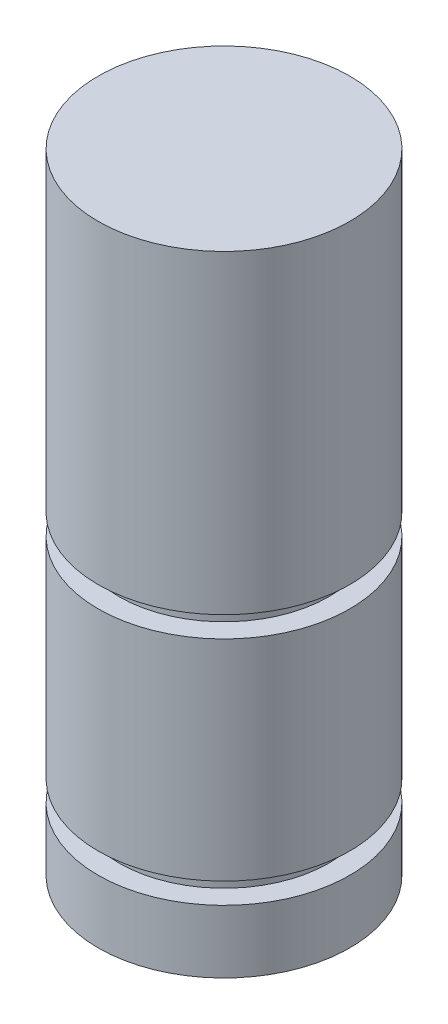
from build123d import *

# Parameters (mm, degrees)
SKETCH1_R           = 6
BOSS_EXTRUDE1_DEPTH = 30
SKETCH2_R           = 1.95
CUT_EXTRUDE1_DEPTH  = 10
SKETCH3_R           = 6
SKETCH3_R_2         = 5
CUT_EXTRUDE2_DEPTH  = 1
CUT_EXTRUDE3_START  = 1
SKETCH4_R           = 6
SKETCH4_R_2         = 5
CUT_EXTRUDE3_DEPTH  = 1


with BuildPart() as part:
    # Sketch1 → Boss-Extrude1 (new body)
    with BuildSketch(Plane(origin=(0, 0, 0), x_dir=(1, 0, 0), z_dir=(0, 1, 0))):
        Circle(SKETCH1_R)
    extrude(amount=BOSS_EXTRUDE1_DEPTH)

    # Sketch2 → Cut-Extrude1 (cut)
    with BuildSketch(Plane.XZ):
        Circle(SKETCH2_R)
    extrude(amount=-CUT_EXTRUDE1_DEPTH, mode=Mode.SUBTRACT)

    # Sketch3 → Cut-Extrude2 (cut)
    with BuildSketch(Plane(origin=(0, 14, 0), x_dir=(-1, 0, 0), z_dir=(0, -1, 0))):
        Circle(SKETCH3_R)
        Circle(SKETCH3_R_2, mode=Mode.SUBTRACT)
    extrude(amount=-CUT_EXTRUDE2_DEPTH, mode=Mode.SUBTRACT)

    # Sketch4 → Cut-Extrude3 (cut)
    with BuildSketch(Plane(origin=(0, 4, 0), x_dir=(-1, 0, 0), z_dir=(0, -1, 0)).offset(CUT_EXTRUDE3_START)):
        Circle(SKETCH4_R)
        Circle(SKETCH4_R_2, mode=Mode.SUBTRACT)
    extrude(amount=-CUT_EXTRUDE3_DEPTH, mode=Mode.SUBTRACT)


solid = part.part
